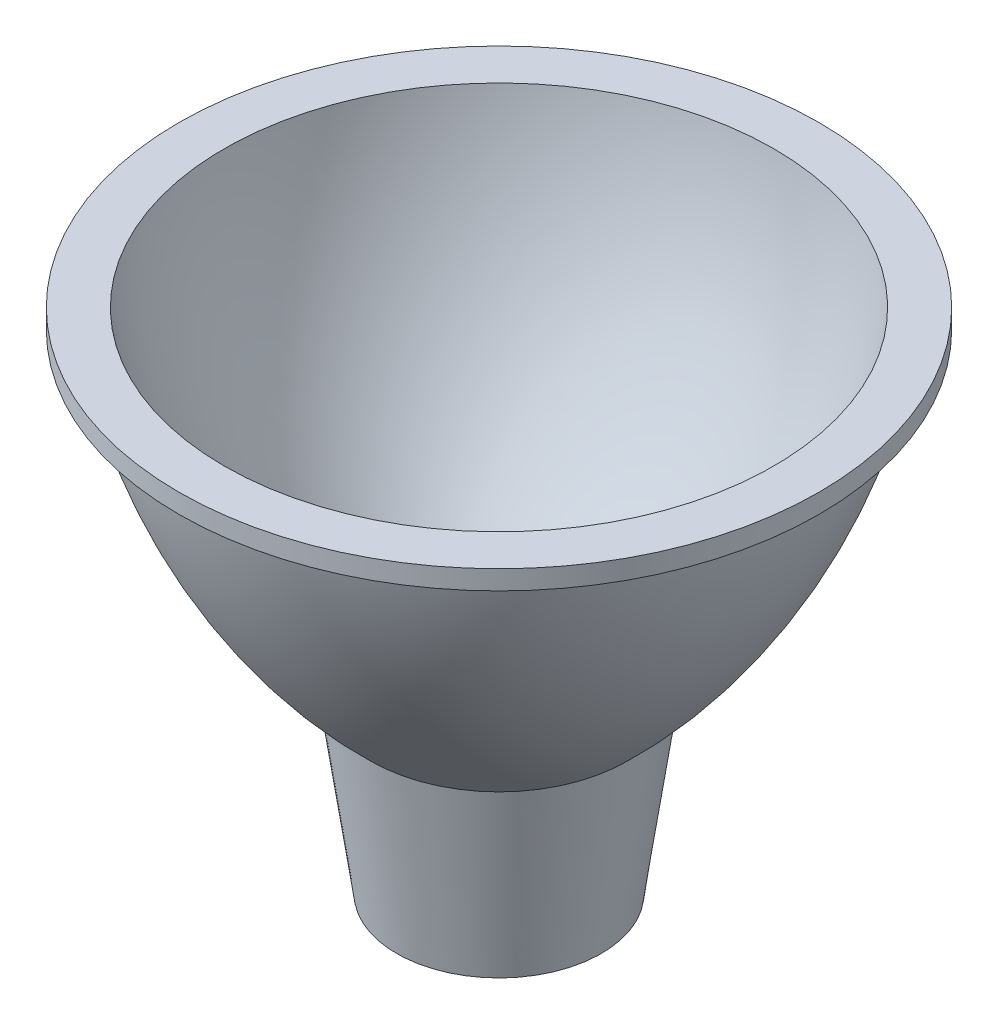
from build123d import *


# Read off the part's stored shape, not the designer's step: 抽壳1
with BuildPart() as part:
    # 草图3 → 旋转1 (revolve)
    with BuildSketch(Plane.XY, mode=Mode.PRIVATE) as revolve_1_sk:
        with BuildLine():
            Line((0, 0), (-8, 0))
            Line((-8, 0), (-10, 14))
            ThreePointArc((-10, 14), (-18.477025854, 25.080270137), (-23.220973783, 38.2))
            Line((-23.220973783, 38.2), (-25, 38.2))
            Line((-25, 38.2), (-25, 39.7))
            Line((-25, 39.7), (0, 39.7))
            Line((0, 39.7), (0, 0))
        make_face()
    revolve(revolve_1_sk.sketch.rotate(Axis((0, 0, 0), (0, 1, 0)), 270), axis=Axis((0, 0, 0), (0, 1, 0)))

    # 抽壳1 outline → 抽壳1 (revolve, cut)
    with BuildSketch(Plane.XY):
        with BuildLine():
            Line((6.265409197, 2), (8.118872407, 14.974242471))
            ThreePointArc((8.118872407, 14.974242471), (16.829276005, 26.23694427), (21.462386525, 39.7))
            Line((21.462386525, 39.7), (0, 39.7))
            Line((0, 39.7), (0, 2))
            Line((0, 2), (6.265409197, 2))
        make_face()
    revolve(axis=Axis((0, 0, 0), (0, 1, 0)), mode=Mode.SUBTRACT)


solid = part.part
